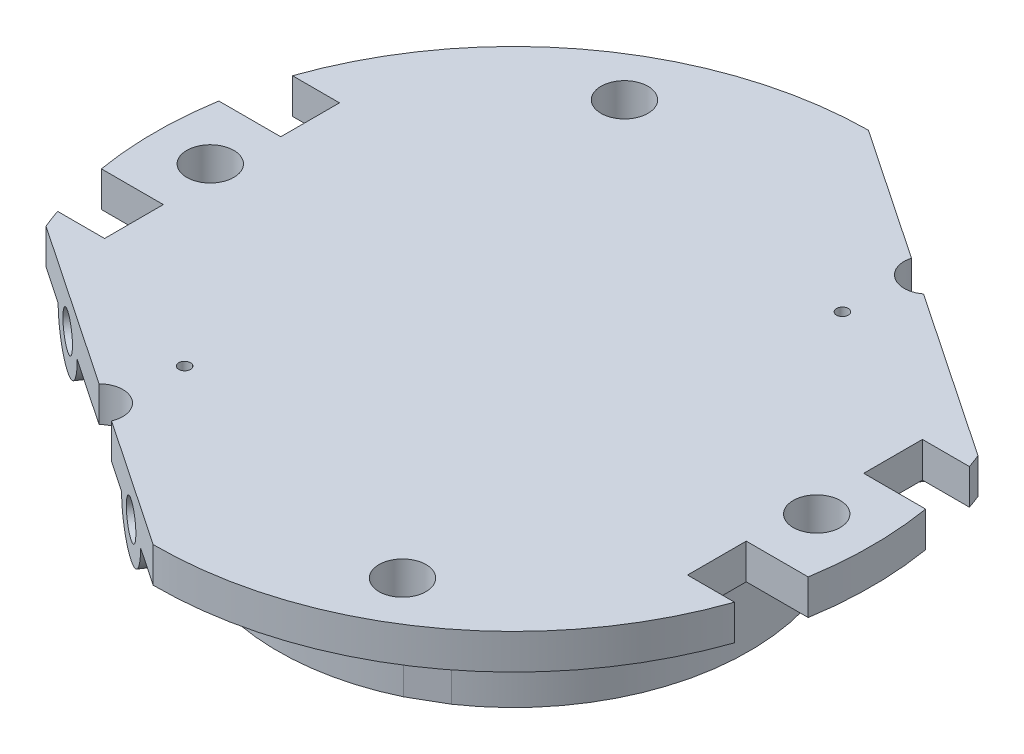
from build123d import *

# Parameters (mm, degrees)
CROQUIS1_R              = 30.5
SALIENTE_EXTRUIR1_DEPTH = 3
CORTAR_EXTRUIR3_START   = -4
CORTAR_EXTRUIR3_DEPTH   = 4
CROQUIS7_R              = 2
CORTAR_EXTRUIR4_DEPTH   = 10
CROQUIS8_R              = 0.5
CORTAR_EXTRUIR5_DEPTH   = 3
SALIENTE_EXTRUIR2_DEPTH = 13
CROQUIS11_W             = 34.583232932
CROQUIS11_H             = 3
SALIENTE_EXTRUIR3_DEPTH = 6
CROQUIS12_R             = 2
CORTAR_EXTRUIR7_DEPTH   = 3
CROQUIS13_R             = 3
SALIENTE_EXTRUIR4_DEPTH = 20
CROQUIS14_R             = 1.5
CORTAR_EXTRUIR8_DEPTH   = 6
CORTAR_EXTRUIR9_START   = -3
CORTAR_EXTRUIR9_DEPTH   = 3
CROQUIS16_W             = 33.68877148
CROQUIS16_H             = 3
SALIENTE_EXTRUIR5_DEPTH = 6
CROQUIS17_R             = 2
CORTAR_EXTRUIR10_DEPTH  = 3
CROQUIS18_R             = 3
SALIENTE_EXTRUIR6_DEPTH = 25
CROQUIS19_R             = 1.5
CORTAR_EXTRUIR11_DEPTH  = 5
CORTAR_EXTRUIR12_DEPTH  = 6
CORTAR_EXTRUIR13_DEPTH  = 6
CROQUIS22_R             = 1.5
CORTAR_EXTRUIR14_DEPTH  = 6
CROQUIS23_R             = 1.5
CORTAR_EXTRUIR15_DEPTH  = 6


with BuildPart() as part:
    # Croquis1 → Saliente-Extruir1 (new body)
    with BuildSketch(Plane(origin=(0, 0, 0), x_dir=(1, 0, 0), z_dir=(0, 1, 0))):
        Circle(CROQUIS1_R)
    extrude(amount=SALIENTE_EXTRUIR1_DEPTH)

    # Croquis5 → Cortar-Extruir3 (cut)
    with BuildSketch(Plane(origin=(0, 3, 0), x_dir=(1, 0, 0), z_dir=(0, 1, 0)).offset(CORTAR_EXTRUIR3_START)):
        with BuildLine():
            Line((30.087372767, -5), (24.814059068, -5))
            Line((24.814059068, -5), (24.814059068, -10))
            Line((24.814059068, -10), (28.814059068, -10))
            ThreePointArc((28.814059068, -10), (29.556634924, -7.526973624), (30.087372767, -5))
        make_face()
        with BuildLine():
            ThreePointArc((-30.087372767, -5), (-29.556634924, -7.526973624), (-28.814059068, -10))
            Line((-28.814059068, -10), (-24.814059068, -10))
            Line((-24.814059068, -10), (-24.814059068, -5))
            Line((-24.814059068, -5), (-30.087372767, -5))
        make_face()
        with BuildLine():
            Line((24.814059068, 5), (30.087372767, 5))
            ThreePointArc((30.087372767, 5), (29.556634924, 7.526973624), (28.814059068, 10))
            Line((28.814059068, 10), (24.814059068, 10))
            Line((24.814059068, 10), (24.814059068, 5))
        make_face()
        with BuildLine():
            ThreePointArc((-28.814059068, 10), (-29.556634924, 7.526973624), (-30.087372767, 5))
            Line((-30.087372767, 5), (-24.814059068, 5))
            Line((-24.814059068, 5), (-24.814059068, 10))
            Line((-24.814059068, 10), (-28.814059068, 10))
        make_face()
    extrude(amount=CORTAR_EXTRUIR3_DEPTH, mode=Mode.SUBTRACT)

    # Croquis7 → Cortar-Extruir4 (cut)
    with BuildSketch(Plane(origin=(0, 3, 0), x_dir=(1, 0, 0), z_dir=(0, 1, 0))):
        with Locations((25.81405907, 0)):
            Circle(CROQUIS7_R)
        with Locations((12.907029535, 22.355630929)):
            Circle(CROQUIS7_R)
        with Locations((12.907029535, -22.355630929)):
            Circle(CROQUIS7_R)
        with Locations((-12.907029535, 22.355630929)):
            Circle(CROQUIS7_R)
        with Locations((-12.907029535, -22.355630929)):
            Circle(CROQUIS7_R)
        with Locations((-25.81405907, 0)):
            Circle(CROQUIS7_R)
    extrude(amount=-CORTAR_EXTRUIR4_DEPTH, mode=Mode.SUBTRACT)

    # Croquis8 → Cortar-Extruir5 (cut)
    with BuildSketch(Plane(origin=(0, 3, 0), x_dir=(1, 0, 0), z_dir=(0, 1, 0))):
        with Locations((12, 16)):
            Circle(CROQUIS8_R)
        with Locations((-12, -16)):
            Circle(CROQUIS8_R)
    extrude(amount=-CORTAR_EXTRUIR5_DEPTH, mode=Mode.SUBTRACT)

    # Croquis9 → Saliente-Extruir2 (add)
    with BuildSketch(Plane(origin=(0, 3, 0), x_dir=(1, 0, 0), z_dir=(0, 1, 0))):
        with BuildLine():
            Line((-8.700961894, 18.070508076), (-10, 17.320508076))
            Line((-10, 17.320508076), (-11.299038106, 16.570508076))
            ThreePointArc((-11.299038106, 16.570508076), (-19.960969499, 1.951844427), (-14.294950117, -14.067849912))
            ThreePointArc((-14.294950117, -14.067849912), (-10.97161543, -13.181769141), (-9, -16))
            ThreePointArc((-9, -16), (-9.12838457, -16.868230859), (-9.502549883, -17.662150088))
            ThreePointArc((-9.502549883, -17.662150088), (-0.449805389, -20.05112653), (8.700961894, -18.070508076))
            Line((8.700961894, -18.070508076), (10, -17.320508076))
            Line((10, -17.320508076), (11.299038106, -16.570508076))
            ThreePointArc((11.299038106, -16.570508076), (17.732250869, -9.371087404), (20.05617112, 0))
            ThreePointArc((20.05617112, 0), (18.560064193, 7.600922125), (14.294950117, 14.067849912))
            ThreePointArc((14.294950117, 14.067849912), (10.2, 13.6), (9.502549883, 17.662150088))
            ThreePointArc((9.502549883, 17.662150088), (0.449805389, 20.05112653), (-8.700961894, 18.070508076))
        make_face()
    extrude(amount=-SALIENTE_EXTRUIR2_DEPTH)

    # Croquis11 → Saliente-Extruir3 (add)
    with BuildSketch(Plane(origin=(14.04954782, 0, -20.829311224), x_dir=(-0.8290375725550414, 0, -0.5591929034707472), z_dir=(0.5591929034707472, 0, -0.8290375725550414))):
        with Locations((0, 1.5)):
            Rectangle(CROQUIS11_W, CROQUIS11_H)
    extrude(amount=SALIENTE_EXTRUIR3_DEPTH)

    # Croquis12 → Cortar-Extruir7 (cut)
    with BuildSketch(Plane(origin=(0, 3, 0), x_dir=(1, 0, 0), z_dir=(0, 1, 0))):
        with Locations((12.907029535, 22.355630929)):
            Circle(CROQUIS12_R)
    extrude(amount=-CORTAR_EXTRUIR7_DEPTH, mode=Mode.SUBTRACT)

    # Croquis13 → Saliente-Extruir4 (add)
    # profile 1 of 2: a face of its own
    with BuildSketch(Plane(origin=(17.404705241, 0, -25.803536659), x_dir=(-0.8290375725550414, 0, -0.5591929034707472), z_dir=(0.5591929034707472, 0, -0.8290375725550414))):
        with Locations((-10, 0)):
            Circle(CROQUIS13_R)
        with BuildLine():
            ThreePointArc((-11.5, 0), (-10, 1.5), (-8.5, 0))
            Line((-8.5, 0), (-11.5, 0))
        make_face(mode=Mode.SUBTRACT)
    # profile 2 of 2: a face of its own
    with BuildSketch(Plane(origin=(17.404705241, 0, -25.803536659), x_dir=(-0.8290375725550414, 0, -0.5591929034707472), z_dir=(0.5591929034707472, 0, -0.8290375725550414))):
        with Locations((10, 0)):
            Circle(CROQUIS13_R)
        with BuildLine():
            ThreePointArc((8.5, 0), (10, 1.5), (11.5, 0))
            Line((11.5, 0), (8.5, 0))
        make_face(mode=Mode.SUBTRACT)
    extrude(amount=-SALIENTE_EXTRUIR4_DEPTH)

    # Croquis14 → Cortar-Extruir8 (cut)
    with BuildSketch(Plane(origin=(17.404705241, 0, -25.803536659), x_dir=(-0.8290375725550414, 0, -0.5591929034707472), z_dir=(0.5591929034707472, 0, -0.8290375725550414))):
        with Locations((-10, 0)):
            Circle(CROQUIS14_R)
        with Locations((10, 0)):
            Circle(CROQUIS14_R)
    extrude(amount=-CORTAR_EXTRUIR8_DEPTH, mode=Mode.SUBTRACT)

    # Croquis15 → Cortar-Extruir9 (cut)
    with BuildSketch(Plane(origin=(0, 3, 0), x_dir=(1, 0, 0), z_dir=(0, 1, 0)).offset(CORTAR_EXTRUIR9_START)):
        with BuildLine():
            ThreePointArc((-28.212513648, -11.588963441), (-17.055383556, -25.285645963), (-0.176506165, -30.499489267))
            Line((-0.176506165, -30.499489267), (-11.071782568, -23.15053254))
            ThreePointArc((-11.071782568, -23.15053254), (-14.025415342, -24.013706075), (-14.331545089, -20.951794957))
            Line((-14.331545089, -20.951794957), (-28.212513648, -11.588963441))
        make_face()
    extrude(amount=CORTAR_EXTRUIR9_DEPTH, mode=Mode.SUBTRACT)

    # Croquis16 → Saliente-Extruir5 (add)
    with BuildSketch(Plane(origin=(-14.194509906, 0, 21.044226354), x_dir=(0.8290375725550415, 0, 0.5591929034707472), z_dir=(-0.5591929034707471, 0, 0.8290375725550414))):
        with Locations((-0.064381976, 1.5)):
            Rectangle(CROQUIS16_W, CROQUIS16_H)
    extrude(amount=SALIENTE_EXTRUIR5_DEPTH)

    # Croquis17 → Cortar-Extruir10 (cut)
    with BuildSketch(Plane(origin=(0, 3, 0), x_dir=(1, 0, 0), z_dir=(0, 1, 0))):
        with Locations((-12.907029535, -22.355630929)):
            Circle(CROQUIS17_R)
    extrude(amount=-CORTAR_EXTRUIR10_DEPTH, mode=Mode.SUBTRACT)

    # Croquis18 → Saliente-Extruir6 (add)
    with BuildSketch(Plane(origin=(-17.549667327, 0, 26.01845179), x_dir=(0.8290375725550416, 0, 0.5591929034707471), z_dir=(-0.5591929034707471, 0, 0.8290375725550416))):
        with Locations((9.935618024, 0)):
            Circle(CROQUIS18_R)
        with Locations((-10.064381976, 0)):
            Circle(CROQUIS18_R)
    extrude(amount=-SALIENTE_EXTRUIR6_DEPTH)

    # Croquis19 → Cortar-Extruir11 (cut)
    with BuildSketch(Plane(origin=(-17.549667327, 0, 26.01845179), x_dir=(0.8290375725550416, 0, 0.5591929034707471), z_dir=(-0.5591929034707471, 0, 0.8290375725550416))):
        with Locations((-10.064381976, 0)):
            Circle(CROQUIS19_R)
        with Locations((9.935618024, 0)):
            Circle(CROQUIS19_R)
    extrude(amount=-CORTAR_EXTRUIR11_DEPTH, mode=Mode.SUBTRACT)

    # Croquis20 → Cortar-Extruir12 (cut)
    with BuildSketch(Plane(origin=(17.404705241, 0, -25.803536659), x_dir=(-0.8290375725550413, 0, -0.5591929034707475), z_dir=(0.5591929034707475, 0, -0.8290375725550414))):
        with BuildLine():
            Line((17.291616466, 3), (17.291616466, 0))
            Line((17.291616466, 0), (13, 0))
            ThreePointArc((13, 0), (10, -3), (7, 0))
            Line((7, 0), (-7, 0))
            ThreePointArc((-7, 0), (-10, -3), (-13, 0))
            Line((-13, 0), (-17.291616466, 0))
            Line((-17.291616466, 0), (-17.291616466, 3))
            Line((-17.291616466, 3), (17.291616466, 3))
        make_face()
    extrude(amount=-CORTAR_EXTRUIR12_DEPTH, mode=Mode.SUBTRACT)

    # Croquis21 → Cortar-Extruir13 (cut)
    with BuildSketch(Plane(origin=(-17.549667327, 0, 26.01845179), x_dir=(0.8290375725550416, 0, 0.5591929034707471), z_dir=(-0.5591929034707471, 0, 0.8290375725550416))):
        with BuildLine():
            Line((-13.064381976, 0), (-16.908767716, 0))
            Line((-16.908767716, 0), (-16.908767716, 3))
            Line((-16.908767716, 3), (16.780003764, 3))
            Line((16.780003764, 3), (16.780003764, 0))
            Line((16.780003764, 0), (12.935618024, 0))
            ThreePointArc((12.935618024, 0), (9.935618024, -3), (6.935618024, 0))
            Line((6.935618024, 0), (-7.064381976, 0))
            ThreePointArc((-7.064381976, 0), (-10.064381976, -3), (-13.064381976, 0))
        make_face()
    extrude(amount=-CORTAR_EXTRUIR13_DEPTH, mode=Mode.SUBTRACT)

    # Croquis22 → Cortar-Extruir14 (cut)
    with BuildSketch(Plane(origin=(-14.194509906, 0, 21.044226354), x_dir=(0.8290375725550415, 0, 0.5591929034707471), z_dir=(-0.5591929034707471, 0, 0.8290375725550415))):
        with Locations((-10.064381976, 0)):
            Circle(CROQUIS22_R)
        with Locations((9.935618024, 0)):
            Circle(CROQUIS22_R)
    extrude(amount=-CORTAR_EXTRUIR14_DEPTH, mode=Mode.SUBTRACT)

    # Croquis23 → Cortar-Extruir15 (cut)
    with BuildSketch(Plane(origin=(14.04954782, 0, -20.829311224), x_dir=(-0.8290375725550414, 0, -0.5591929034707472), z_dir=(0.5591929034707472, 0, -0.8290375725550414))):
        with Locations((-10, 0)):
            Circle(CROQUIS23_R)
        with Locations((10, 0)):
            Circle(CROQUIS23_R)
    extrude(amount=-CORTAR_EXTRUIR15_DEPTH, mode=Mode.SUBTRACT)


solid = part.part
